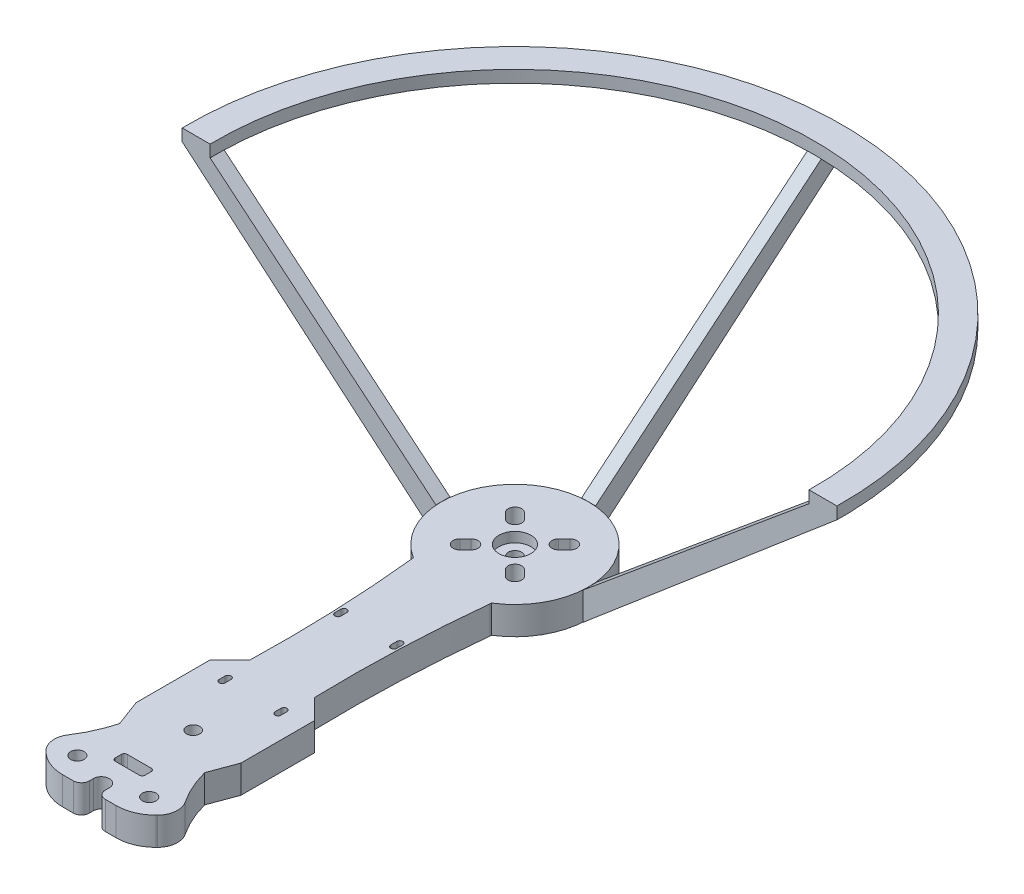
from build123d import *
from OCP.BRepFilletAPI import BRepFilletAPI_MakeChamfer

# Parameters (mm, degrees)
SKETCH1_W                                       = 20
SKETCH1_H                                       = 76
BOSS_EXTRUDE1_DEPTH                             = 7
BOSS_EXTRUDE2_DEPTH                             = 7
CUT_EXTRUDE1_DEPTH                              = 72.822318988
BOSS_EXTRUDE3_DEPTH                             = 7
CSK_FOR_M3_FLAT_HEAD_MACHINE_SCREW1_D           = 3.4
CSK_FOR_M3_FLAT_HEAD_MACHINE_SCREW1_CSINK_D     = 6.3
CSK_FOR_M3_FLAT_HEAD_MACHINE_SCREW1_CSINK_ANGLE = 90
CHAMFER3_SIZE                                   = 10
CHAMFER3_SIZE2                                  = 7.071067812
CHAMFER4_SIZE                                   = 3
F_3_3_3_3_DIAMETER_HOLE1_D                      = 3.3
BOSS_EXTRUDE4_DEPTH                             = 7
CUT_EXTRUDE3_DEPTH                              = 72.822318988
F_3_3_3_3_DIAMETER_HOLE2_D                      = 3.3
SKETCH17_W                                      = 1.5
SKETCH17_H                                      = 3
CUT_EXTRUDE5_DEPTH                              = 72.822318988
F_4_0_4_DIAMETER_HOLE1_D                        = 4
CUT_EXTRUDE7_DEPTH                              = 72.822318988
FILLET1_R                                       = 10
FILLET4_R                                       = 10
SKETCH24_R                                      = 4
CUT_EXTRUDE9_DEPTH                              = 2.5
CUT_EXTRUDE11_DEPTH                             = 72.822319119
FILLET6_R                                       = 5
FILLET8_R                                       = 0.75
CUT_EXTRUDE14_DEPTH                             = 72.822319119
FILLET10_R                                      = 2
BOSS_EXTRUDE7_DEPTH                             = 7
SKETCH35_W                                      = 1.5
SKETCH35_H                                      = 3
CUT_EXTRUDE15_DEPTH                             = 72.822319119
SKETCH36_W                                      = 4.5
SKETCH36_H                                      = 3
CUT_EXTRUDE16_DEPTH                             = 3
FILLET11_R                                      = 0.75
SKETCH37_W                                      = 1.5
SKETCH37_H                                      = 3
CUT_EXTRUDE17_DEPTH                             = 72.822319119
FILLET12_R                                      = 0.75
FILLET15_R                                      = 3
BOSS_EXTRUDE8_START                             = -7
BOSS_EXTRUDE8_DEPTH                             = 7
BOSS_EXTRUDE9_DEPTH                             = 1.75
BOSS_EXTRUDE9_2_DEPTH                           = 1.75
BOSS_EXTRUDE11_DEPTH                            = 3
BOSS_EXTRUDE12_DEPTH                            = 1.75


with BuildPart() as part:
    # Sketch1 → Boss-Extrude1 (new body)
    with BuildSketch(Plane(origin=(0, 0, 0), x_dir=(1, 0, 0), z_dir=(0, 1, 0))):
        Rectangle(SKETCH1_W, SKETCH1_H)
    extrude(amount=BOSS_EXTRUDE1_DEPTH)

    # Sketch2 → Boss-Extrude2 (add)
    with BuildSketch(Plane(origin=(0, 7, 0), x_dir=(1, 0, 0), z_dir=(0, 1, 0))):
        Polygon((18, 53.588457268), (9, 69.176914536), (-9, 69.176914536), (-18, 53.588457268), (-10, 39.732050808), (-10, 38), (10, 38), (10, 39.732050808), align=None)
    extrude(amount=-BOSS_EXTRUDE2_DEPTH)

    # Sketch3 → Cut-Extrude1 (cut, through all)
    with BuildSketch(Plane(origin=(0, 7, 0), x_dir=(1, 0, 0), z_dir=(0, 1, 0))):
        with BuildLine():
            Line((-8.096372645, 47.89624768), (-6.682159082, 49.310461242))
            ThreePointArc((-6.682159082, 49.310461242), (-4.277996026, 49.310461242), (-4.277996026, 46.906298186))
            Line((-4.277996026, 46.906298186), (-5.692209589, 45.492084624))
            ThreePointArc((-5.692209589, 45.492084624), (-8.096372645, 45.492084624), (-8.096372645, 47.89624768))
        make_face()
        with BuildLine():
            Line((-5.692209589, 61.684829913), (-4.277996026, 60.27061635))
            ThreePointArc((-4.277996026, 60.27061635), (-4.277996026, 57.866453294), (-6.682159082, 57.866453294))
            Line((-6.682159082, 57.866453294), (-8.096372645, 59.280666857))
            ThreePointArc((-8.096372645, 59.280666857), (-8.096372645, 61.684829913), (-5.692209589, 61.684829913))
        make_face()
        with BuildLine():
            Line((8.096372645, 59.280666857), (6.682159082, 57.866453294))
            ThreePointArc((6.682159082, 57.866453294), (4.277996026, 57.866453294), (4.277996026, 60.27061635))
            Line((4.277996026, 60.27061635), (5.692209589, 61.684829913))
            ThreePointArc((5.692209589, 61.684829913), (8.096372645, 61.684829913), (8.096372645, 59.280666857))
        make_face()
        with BuildLine():
            Line((5.692209589, 45.492084624), (4.277996026, 46.906298186))
            ThreePointArc((4.277996026, 46.906298186), (4.277996026, 49.310461242), (6.682159082, 49.310461242))
            Line((6.682159082, 49.310461242), (8.096372645, 47.89624768))
            ThreePointArc((8.096372645, 47.89624768), (8.096372645, 45.492084624), (5.692209589, 45.492084624))
        make_face()
    extrude(amount=-CUT_EXTRUDE1_DEPTH, mode=Mode.SUBTRACT)

    # Sketch5 → Boss-Extrude3 (add)
    with BuildSketch(Plane(origin=(0, 7, 0), x_dir=(1, 0, 0), z_dir=(0, 1, 0))):
        Polygon((10, -38), (-10, -38), (-25, -53), (25, -53), align=None)
    extrude(amount=-BOSS_EXTRUDE3_DEPTH)

    # CSK for M3 Flat Head Machine Screw1 (through all)
    with Locations(Plane(origin=(0, 0, 0), x_dir=(-1, 0, 0), z_dir=(0, -1, 0))):
        with Locations((9, -47), (-9, -47)):
            CounterSinkHole(CSK_FOR_M3_FLAT_HEAD_MACHINE_SCREW1_D / 2, CSK_FOR_M3_FLAT_HEAD_MACHINE_SCREW1_CSINK_D / 2, counter_sink_angle=CSK_FOR_M3_FLAT_HEAD_MACHINE_SCREW1_CSINK_ANGLE)

    # Chamfer3: one chamfer whose edges measure the first distance from different faces: ONE call of the kernel's chamfer builder (chamfer() names one face for all edges)
    chamfer3_edges_1 = [part.edges().sort_by_distance(p)[0] for p in [
        (-25, 3.5, 53),
    ]]
    chamfer3_side_1 = [part.faces().sort_by_distance(p)[0] for p in [
        (-17.5, 3.5, 45.5),
    ]]
    chamfer3_edges_2 = [part.edges().sort_by_distance(p)[0] for p in [
        (25, 3.5, 53),
    ]]
    chamfer3_side_2 = [part.faces().sort_by_distance(p)[0] for p in [
        (17.5, 3.5, 45.5),
    ]]
    chamfer3 = BRepFilletAPI_MakeChamfer(part.part.solid().wrapped)
    for e in chamfer3_edges_1:
        chamfer3.Add(CHAMFER3_SIZE, CHAMFER3_SIZE2, e.wrapped, chamfer3_side_1[0].wrapped)  # the first distance lies on this face
    for e in chamfer3_edges_2:
        chamfer3.Add(CHAMFER3_SIZE, CHAMFER3_SIZE2, e.wrapped, chamfer3_side_2[0].wrapped)  # the first distance lies on this face
    add(Compound.cast(chamfer3.Shape()), mode=Mode.REPLACE)

    # Chamfer4
    chamfer4_edges = [part.edges().sort_by_distance(p)[0] for p in [
        (17.928932188, 3.5, 53),
        (-17.928932188, 3.5, 53),
    ]]
    chamfer(chamfer4_edges, length=CHAMFER4_SIZE)

    # Ø3.3 (3.3) Diameter Hole1 (through all)
    with Locations(Plane(origin=(0, 0, 0), x_dir=(-1, 0, 0), z_dir=(0, -1, 0))):
        with Locations((0, -27)):
            Hole(F_3_3_3_3_DIAMETER_HOLE1_D / 2)

    # Sketch12 → Boss-Extrude4 (add, through all)
    with BuildSketch(Plane(origin=(0, 7, 0), x_dir=(1, 0, 0), z_dir=(0, 1, 0))):
        Polygon((-17.928932188, -45.928932188), (-10, -32.195618789), (-10, -38), align=None)
        Polygon((10, -38), (17.928932188, -45.928932188), (10, -32.195618789), align=None)
    extrude(amount=-BOSS_EXTRUDE4_DEPTH)

    # Sketch13 → Cut-Extrude3 (cut, through all)
    with BuildSketch(Plane.XZ):
        Polygon((-17.928932188, 45.928932188), (-10.857864376, 53), (-14.928932188, 53), (-17.928932188, 50), align=None)
        Polygon((17.928932188, 50), (17.928932188, 45.928932188), (10.857864376, 53), (14.928932188, 53), align=None)
    extrude(amount=-CUT_EXTRUDE3_DEPTH, mode=Mode.SUBTRACT)

    # Ø3.3 (3.3) Diameter Hole2 (through all)
    with Locations(Plane(origin=(0, 7, 0), x_dir=(1, 0, 0), z_dir=(0, 1, 0))):
        with Locations((0, 53.588457268)):
            Hole(F_3_3_3_3_DIAMETER_HOLE2_D / 2)

    # Sketch17 → Cut-Extrude5 (cut, through all)
    with BuildSketch(Plane(origin=(0, 7, 0), x_dir=(1, 0, 0), z_dir=(0, 1, 0))):
        with Locations((7, 17)):
            Rectangle(SKETCH17_W, SKETCH17_H)
        with Locations((-7, 17)):
            Rectangle(SKETCH17_W, SKETCH17_H)
    extrude(amount=-CUT_EXTRUDE5_DEPTH, mode=Mode.SUBTRACT)

    # Ø4.0 (4) Diameter Hole1 (through all)
    with Locations(Plane(origin=(0, 0, 0), x_dir=(-1, 0, 0), z_dir=(0, -1, 0))):
        with Locations((0, -50)):
            Hole(F_4_0_4_DIAMETER_HOLE1_D / 2)

    # Sketch22 → Cut-Extrude7 (cut, through all)
    with BuildSketch(Plane(origin=(0, 7, 0), x_dir=(1, 0, 0), z_dir=(0, 1, 0))):
        with BuildLine():
            Line((10, 39.732050808), (10, -32.195618789))
            add(Edge.make_bspline(
                [(10, -32.195618789), (6, 3.76821601), (10, 39.732050808)],
                knots=[0, 0, 0, 1, 1, 1], degree=2))
        make_face()
        with BuildLine():
            Line((-10, 39.732050808), (-10, -32.195618789))
            add(Edge.make_bspline(
                [(-10, -32.195618789), (-6, 3.76821601), (-10, 39.732050808)],
                knots=[0, 0, 0, 1, 1, 1], degree=2))
        make_face()
    extrude(amount=-CUT_EXTRUDE7_DEPTH, mode=Mode.SUBTRACT)

    # Fillet1
    fillet1_edges = [part.edges().sort_by_distance(p)[0] for p in [
        (-10, 3.5, -39.732050808),
        (10, 3.5, -39.732050808),
        (-10, 3.5, 32.195618789),
        (10, 3.5, 32.195618789),
    ]]
    fillet(fillet1_edges, radius=FILLET1_R)

    # Fillet4
    fillet4_edges = [part.edges().sort_by_distance(p)[0] for p in [
        (-10.857864376, 3.5, 53),
        (10.857864376, 3.5, 53),
    ]]
    fillet(fillet4_edges, radius=FILLET4_R)

    # Sketch24 → Cut-Extrude9 (cut)
    with BuildSketch(Plane(origin=(0, 7, 0), x_dir=(1, 0, 0), z_dir=(0, 1, 0))):
        with Locations(Location((0, 53.588457268, 0), (0, 0, 270))):
            Circle(SKETCH24_R)
    extrude(amount=-CUT_EXTRUDE9_DEPTH, mode=Mode.SUBTRACT)

    # Sketch26 → Cut-Extrude11 (cut, through all)
    with BuildSketch(Plane(origin=(0, 7, 0), x_dir=(1, 0, 0), z_dir=(0, 1, 0))):
        with BuildLine():
            Line((17.151114729, -46.706749647), (17.928932188, -45.928932188))
            Line((17.928932188, -45.928932188), (9.76997353, -30.064306701))
            add(Edge.make_bspline(
                [(9.76997353, -30.064306701), (10.380683855, -35.901080693), (12.922234489, -42.477869407), (17.151114729, -46.706749647)],
                knots=[0, 0, 0, 0, 1, 1, 1, 1], degree=3))
        make_face()
        with BuildLine():
            Line((-17.928932188, -45.928932188), (-9.76997353, -30.064306701))
            add(Edge.make_bspline(
                [(-9.76997353, -30.064306701), (-10.380683855, -35.901080693), (-12.922234489, -42.477869407), (-17.151114729, -46.706749647)],
                knots=[0, 0, 0, 0, 1, 1, 1, 1], degree=3))
            Line((-17.151114729, -46.706749647), (-17.928932188, -45.928932188))
        make_face()
    extrude(amount=-CUT_EXTRUDE11_DEPTH, mode=Mode.SUBTRACT)

    # Fillet6
    fillet6_edges = [part.edges().sort_by_distance(p)[0] for p in [
        (-17.151114729, 3.5, 46.706749647),
        (17.151114729, 3.5, 46.706749647),
    ]]
    fillet(fillet6_edges, radius=FILLET6_R)

    # Fillet8
    fillet8_edges = [part.edges().sort_by_distance(p)[0] for p in [
        (7.75, 3.5, -18.5),
        (6.25, 3.5, -18.5),
        (7.75, 3.5, -15.5),
        (6.25, 3.5, -15.5),
        (-7.75, 3.5, -18.5),
        (-7.75, 3.5, -15.5),
        (-6.25, 3.5, -15.5),
        (-6.25, 3.5, -18.5),
    ]]
    fillet(fillet8_edges, radius=FILLET8_R - 0.0001)  # a hair under: the kernel refuses the full size

    # Sketch32 → Cut-Extrude14 (cut, through all)
    with BuildSketch(Plane.XZ):
        with BuildLine():
            Line((2, 50), (2, 53))
            Line((2, 53), (-2, 53))
            Line((-2, 53), (-2, 50))
            ThreePointArc((-2, 50), (0, 52), (2, 50))
        make_face()
    extrude(amount=-CUT_EXTRUDE14_DEPTH, mode=Mode.SUBTRACT)

    # Fillet10
    fillet10_edges = [part.edges().sort_by_distance(p)[0] for p in [
        (-2, 3.5, 53),
        (2, 3.5, 53),
    ]]
    fillet(fillet10_edges, radius=FILLET10_R)

    # Sketch33 → Boss-Extrude7 (add, through all)
    with BuildSketch(Plane(origin=(0, 7, 0), x_dir=(1, 0, 0), z_dir=(0, 1, 0))):
        Polygon((-13.112996518, -28.151314757), (-10.651607831, -34.780158226), (-8.670217066, -31.119081351), (-8.112996518, -4.780158226), (-13.112996518, -9.780158226), align=None)
    boss_extrude7 = extrude(amount=-BOSS_EXTRUDE7_DEPTH)

    # Sketch35 → Cut-Extrude15 (cut, through all)
    with BuildSketch(Plane(origin=(0, 7, 0), x_dir=(1, 0, 0), z_dir=(0, 1, 0))):
        with Locations((3, -42)):
            Rectangle(SKETCH35_W, SKETCH35_H)
        with Locations((-3, -42)):
            Rectangle(SKETCH35_W, SKETCH35_H)
    extrude(amount=-CUT_EXTRUDE15_DEPTH, mode=Mode.SUBTRACT)

    # Sketch36 → Cut-Extrude16 (cut)
    with BuildSketch(Plane(origin=(0, 7, 0), x_dir=(1, 0, 0), z_dir=(0, 1, 0))):
        with Locations((0, -42)):
            Rectangle(SKETCH36_W, SKETCH36_H)
    extrude(amount=-CUT_EXTRUDE16_DEPTH, mode=Mode.SUBTRACT)

    # Fillet11
    fillet11_edges = [part.edges().sort_by_distance(p)[0] for p in [
        (-3.75, 3.5, 43.5),
        (-2.25, 2, 40.5),
        (-2.25, 2, 43.5),
        (2.25, 2, 43.5),
        (2.25, 2, 40.5),
        (3.75, 3.5, 40.5),
        (3.75, 3.5, 43.5),
        (-3.75, 3.5, 40.5),
    ]]
    fillet(fillet11_edges, radius=FILLET11_R - 0.0001)  # a hair under: the kernel refuses the full size

    # Mirror6: Boss-Extrude7 across plane
    add(boss_extrude7.mirror(Plane(origin=(0, 0, 0), x_dir=(0, 0, 1), z_dir=(1, 0, 0))))

    # Sketch37 → Cut-Extrude17 (cut, through all)
    with BuildSketch(Plane(origin=(0, 7, 0), x_dir=(1, 0, 0), z_dir=(0, 1, 0))):
        with Locations((7, -12)):
            Rectangle(SKETCH37_W, SKETCH37_H)
        with Locations((-7, -12)):
            Rectangle(SKETCH37_W, SKETCH37_H)
    extrude(amount=-CUT_EXTRUDE17_DEPTH, mode=Mode.SUBTRACT)

    # Fillet12
    fillet12_edges = [part.edges().sort_by_distance(p)[0] for p in [
        (6.25, 3.5, 13.5),
        (7.75, 3.5, 10.5),
        (7.75, 3.5, 13.5),
        (6.25, 3.5, 10.5),
        (-7.75, 3.5, 13.5),
        (-6.25, 3.5, 10.5),
        (-6.25, 3.5, 13.5),
        (-7.75, 3.5, 10.5),
    ]]
    fillet(fillet12_edges, radius=FILLET12_R - 0.0001)  # a hair under: the kernel refuses the full size

    # Fillet15
    fillet15_edges = [part.edges().sort_by_distance(p)[0] for p in [
        (18, 3.5, -53.588457268),
        (-18, 3.5, -53.588457268),
        (-9, 3.5, -69.176914536),
        (9, 3.5, -69.176914536),
    ]]
    fillet(fillet15_edges, radius=FILLET15_R)

    # Sketch42 → Boss-Extrude8 (add)
    with BuildSketch(Plane(origin=(0, 7, 0), x_dir=(1, 0, 0), z_dir=(0, 1, 0)).offset(BOSS_EXTRUDE8_START)):
        with BuildLine():
            Line((-9.866025404, 67.676914536), (-17.133974596, 55.088457268))
            ThreePointArc((-17.133974596, 55.088457268), (-17.535898385, 53.588457268), (-17.133974596, 52.088457268))
            Line((-17.133974596, 52.088457268), (-11.055425867, 41.560102033))
            ThreePointArc((-11.055425867, 41.560102033), (-10.263155445, 39.823502305), (-9.815285014, 37.968001533))
            ThreePointArc((-9.815285014, 37.968001533), (0, 72.036721611), (9.815285014, 37.968001533))
            ThreePointArc((9.815285014, 37.968001533), (10.263155445, 39.823502305), (11.055425867, 41.560102033))
            Line((11.055425867, 41.560102033), (17.133974596, 52.088457268))
            ThreePointArc((17.133974596, 52.088457268), (17.535898385, 53.588457268), (17.133974596, 55.088457268))
            Line((17.133974596, 55.088457268), (9.866025404, 67.676914536))
            ThreePointArc((9.866025404, 67.676914536), (8.767949192, 68.774990748), (7.267949192, 69.176914536))
            Line((7.267949192, 69.176914536), (-7.267949192, 69.176914536))
            ThreePointArc((-7.267949192, 69.176914536), (-8.767949192, 68.774990748), (-9.866025404, 67.676914536))
        make_face()
    extrude(amount=BOSS_EXTRUDE8_DEPTH)


with BuildPart() as body_2:
    # Sketch44 → Boss-Extrude9 (new, symmetric)
    with BuildSketch(Plane.XY.offset(-54)):
        Polygon((-18.448264343, 7), (-18.448264343, 0), (-82, 54), (-75, 54), align=None)
    extrude(amount=BOSS_EXTRUDE9_DEPTH, both=True)



with BuildPart() as body_3:
    # Sketch44 → Boss-Extrude9 2 (new, symmetric)
    with BuildSketch(Plane.XY.offset(-54)):
        Polygon((75, 54), (82, 54), (18.448264343, 0), (18.448264343, 7), align=None)
    extrude(amount=BOSS_EXTRUDE9_2_DEPTH, both=True)


with BuildPart() as body_2_1:
    add(body_2.part)

    add(body_3.part)  # Boss-Extrude11 merges body 3
    # Sketch47 → Boss-Extrude11 (add)
    with BuildSketch(Plane(origin=(0, 54, 0), x_dir=(1, 0, 0), z_dir=(0, 1, 0))):
        with BuildLine():
            Line((-75, 52.25), (-82, 52.25))
            ThreePointArc((-82, 52.25), (0, 135.599380125), (82, 52.25))
            Line((82, 52.25), (75, 52.25))
            ThreePointArc((75, 52.25), (0, 128.600399436), (-75, 52.25))
        make_face()
    extrude(amount=BOSS_EXTRUDE11_DEPTH)

    # Sketch45 → Boss-Extrude12 (add, symmetric)
    with BuildSketch(Plane(origin=(0, 0, 0), x_dir=(0, 1, 0), z_dir=(-1, 0, 0))):
        Polygon((0, 72.036721611), (54, 135.599380125), (54, 128.599380125), (7, 72.036721611), align=None)
    extrude(amount=BOSS_EXTRUDE12_DEPTH, both=True)


solid = Compound([part.part, body_2_1.part])
